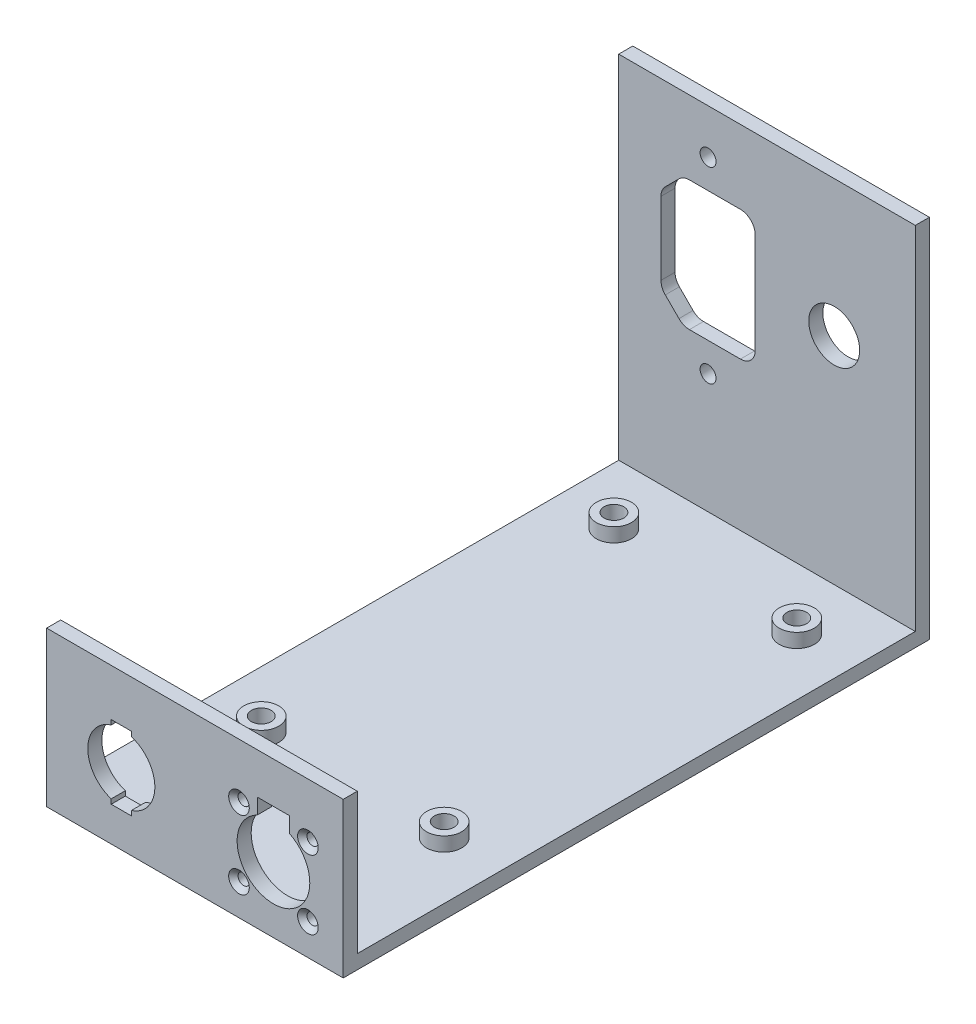
from build123d import *

# Parameters (mm, degrees)
SKETCH_2_R                  = 3.75
EXTRUDE_1_DEPTH             = 3
EXTRUDE_1_2_DEPTH           = 3
EXTRUDE_1_3_DEPTH           = 3
EXTRUDE_1_4_DEPTH           = 3
SKETCH_3_W                  = 63.25
SKETCH_3_H                  = 125
EXTRUDE_2_DEPTH             = 3
SKETCH_4_R                  = 2.1
CUT_EXTRUDE_1_DEPTH         = 4
SKETCH_5_W                  = 63.25
SKETCH_5_H                  = 3
EXTRUDE_3_DEPTH             = 30
CUT_EXTRUDE_2_DEPTH         = 10
HOLE_WIZARD_M21_D           = 2.4
HOLE_WIZARD_M21_DEPTH       = 5
HOLE_WIZARD_M21_CSINK_D     = 4.4
HOLE_WIZARD_M21_CSINK_ANGLE = 90
HOLE_WIZARD_M21_TIP         = 0.721032743
SKETCH_12_W                 = 63.25
SKETCH_12_H                 = 3
EXTRUDE_4_DEPTH             = 75
CUT_EXTRUDE_3_DEPTH         = 146.148684545
HOLE_WIZARD_M31_D           = 3.4
HOLE_WIZARD_M31_DEPTH       = 10
HOLE_WIZARD_M31_TIP         = 1.021463052
SKETCH_16_R                 = 5.425
CUT_EXTRUDE_4_DEPTH         = 146.148684545
CUT_EXTRUDE_5_DEPTH         = 146.148684545


with BuildPart() as part:
    # Эскиз2 → Бобышка-Вытянуть1 (new body)
    with BuildSketch(Plane.XZ):
        with Locations((19.5, 37.6)):
            Circle(SKETCH_2_R)
    extrude(amount=EXTRUDE_1_DEPTH)



with BuildPart() as body_2:
    # Эскиз2 → Extrude 1 2 (new body)
    with BuildSketch(Plane.XZ):
        with Locations((19.5, -37.6)):
            Circle(SKETCH_2_R)
    extrude(amount=EXTRUDE_1_2_DEPTH)


with BuildPart() as body_3:
    # Эскиз2 → Extrude 1 3 (new body)
    with BuildSketch(Plane.XZ):
        with Locations((-19.5, -37.6)):
            Circle(SKETCH_2_R)
    extrude(amount=EXTRUDE_1_3_DEPTH)


with BuildPart() as body_4:
    # Эскиз2 → Extrude 1 4 (new body)
    with BuildSketch(Plane.XZ):
        with Locations((-19.5, 37.6)):
            Circle(SKETCH_2_R)
    extrude(amount=EXTRUDE_1_4_DEPTH)


with BuildPart() as part_1:
    add(part.part)

    add(body_2.part)  # Бобышка-Вытянуть2 merges body 2

    add(body_3.part)  # Бобышка-Вытянуть2 merges body 3

    add(body_4.part)  # Бобышка-Вытянуть2 merges body 4
    # Эскиз3 → Бобышка-Вытянуть2 (add)
    with BuildSketch(Plane.XZ.offset(3)):
        with Locations((0, 8.75)):
            Rectangle(SKETCH_3_W, SKETCH_3_H)
    extrude(amount=EXTRUDE_2_DEPTH)

    # Эскиз4 → Вырез-Вытянуть1 (cut)
    with BuildSketch(Plane(origin=(0, 0, 0), x_dir=(1, 0, 0), z_dir=(0, 1, 0))):
        with Locations((19.5, 37.6)):
            Circle(SKETCH_4_R)
        with Locations((19.5, -37.6)):
            Circle(SKETCH_4_R)
        with Locations((-19.5, -37.6)):
            Circle(SKETCH_4_R)
        with Locations((-19.5, 37.6)):
            Circle(SKETCH_4_R)
    extrude(amount=-CUT_EXTRUDE_1_DEPTH, mode=Mode.SUBTRACT)

    # Эскиз5 → Бобышка-Вытянуть3 (add)
    with BuildSketch(Plane(origin=(0, -3, 0), x_dir=(1, 0, 0), z_dir=(0, 1, 0))):
        with Locations((0, -69.75)):
            Rectangle(SKETCH_5_W, SKETCH_5_H)
    extrude(amount=EXTRUDE_3_DEPTH)

    # Эскиз8 → Вырез-Вытянуть2 (cut)
    with BuildSketch(Plane.XY.offset(71.25)):
        with BuildLine():
            Line((20.195385143, 14.939740629), (20.195385143, 18.25))
            Line((20.195385143, 18.25), (13.295385143, 18.25))
            Line((13.295385143, 18.25), (13.295385143, 14.939740629))
            ThreePointArc((13.295385143, 14.939740629), (16.745385143, 0.25), (20.195385143, 14.939740629))
        make_face()
    extrude(amount=-CUT_EXTRUDE_2_DEPTH, mode=Mode.SUBTRACT)

    # Зенковка для винта с полупотайной головкой M21
    with Locations(Plane.XY.offset(71.25)):
        with Locations((9.395385143, 0.65), (24.095385143, 0.65), (9.395385143, 15.35), (24.095385143, 15.35)):
            CounterSinkHole(HOLE_WIZARD_M21_D / 2, HOLE_WIZARD_M21_CSINK_D / 2, depth=HOLE_WIZARD_M21_DEPTH, counter_sink_angle=HOLE_WIZARD_M21_CSINK_ANGLE)
            with Locations((0, 0, -(HOLE_WIZARD_M21_DEPTH + HOLE_WIZARD_M21_TIP / 2))):  # 118° drill point
                Cone(0, HOLE_WIZARD_M21_D / 2, HOLE_WIZARD_M21_TIP, mode=Mode.SUBTRACT)

    # Эскиз12 → Бобышка-Вытянуть4 (add)
    with BuildSketch(Plane(origin=(0, -3, 0), x_dir=(1, 0, 0), z_dir=(0, 1, 0))):
        with Locations((0, 52.25)):
            Rectangle(SKETCH_12_W, SKETCH_12_H)
    extrude(amount=EXTRUDE_4_DEPTH)

    # Эскиз13 → Вырез-Вытянуть3 (cut, through all)
    with BuildSketch(Plane.XY.offset(-50.75)):
        with BuildLine():
            Line((-16.5475667, 28.661241518), (-5.665207388, 28.661241518))
            ThreePointArc((-5.665207388, 28.661241518), (-3.437821027, 29.583855157), (-2.515207388, 31.811241518))
            Line((-2.515207388, 31.811241518), (-2.515207388, 53.161241518))
            ThreePointArc((-2.515207388, 53.161241518), (-3.437821027, 55.388627878), (-5.665207388, 56.311241518))
            Line((-5.665207388, 56.311241518), (-16.5475667, 56.311241518))
            ThreePointArc((-16.5475667, 56.311241518), (-17.753019512, 56.071462045), (-18.774953061, 55.388627878))
            Line((-18.774953061, 55.388627878), (-21.692593748, 52.470987191))
            ThreePointArc((-21.692593748, 52.470987191), (-22.375427915, 51.449053642), (-22.615207388, 50.243600831))
            Line((-22.615207388, 50.243600831), (-22.615207388, 34.728882205))
            ThreePointArc((-22.615207388, 34.728882205), (-22.375427915, 33.523429393), (-21.692593748, 32.501495844))
            Line((-21.692593748, 32.501495844), (-18.774953061, 29.583855157))
            ThreePointArc((-18.774953061, 29.583855157), (-17.753019512, 28.90102099), (-16.5475667, 28.661241518))
        make_face()
    extrude(amount=-CUT_EXTRUDE_3_DEPTH, mode=Mode.SUBTRACT)

    # Отверстие с зазором M31
    with Locations(Plane(origin=(0, 0, -53.75), x_dir=(-1, 0, 0), z_dir=(0, 0, -1))):
        with Locations((12.565207388, 22.486241518), (12.565207388, 62.486241518)):
            Hole(HOLE_WIZARD_M31_D / 2, depth=HOLE_WIZARD_M31_DEPTH)
            with Locations((0, 0, -(HOLE_WIZARD_M31_DEPTH + HOLE_WIZARD_M31_TIP / 2))):  # 118° drill point
                Cone(0, HOLE_WIZARD_M31_D / 2, HOLE_WIZARD_M31_TIP, mode=Mode.SUBTRACT)

    # Эскиз16 → Вырез-Вытянуть4 (cut, through all)
    with BuildSketch(Plane.XY.offset(-50.75)):
        with Locations((14.332152216, 42.973087252)):
            Circle(SKETCH_16_R)
    extrude(amount=-CUT_EXTRUDE_4_DEPTH, mode=Mode.SUBTRACT)

    # Эскиз17 → Вырез-Вытянуть5 (cut, through all)
    with BuildSketch(Plane(origin=(0, 0, 68.25), x_dir=(-1, 0, 0), z_dir=(0, 0, -1))):
        with BuildLine():
            Line((13.546897834, 15.992570959), (13.546897834, 16.992570959))
            Line((13.546897834, 16.992570959), (17.846897834, 16.992570959))
            Line((17.846897834, 16.992570959), (17.846897834, 15.992570959))
            ThreePointArc((17.846897834, 15.992570959), (22.846897834, 9.17348011), (17.846897834, 2.354389262))
            Line((17.846897834, 2.354389262), (17.846897834, 1.354389262))
            Line((17.846897834, 1.354389262), (13.546897834, 1.354389262))
            Line((13.546897834, 1.354389262), (13.546897834, 2.354389262))
            ThreePointArc((13.546897834, 2.354389262), (8.546897834, 9.17348011), (13.546897834, 15.992570959))
        make_face()
    extrude(amount=-CUT_EXTRUDE_5_DEPTH, mode=Mode.SUBTRACT)


solid = part_1.part
